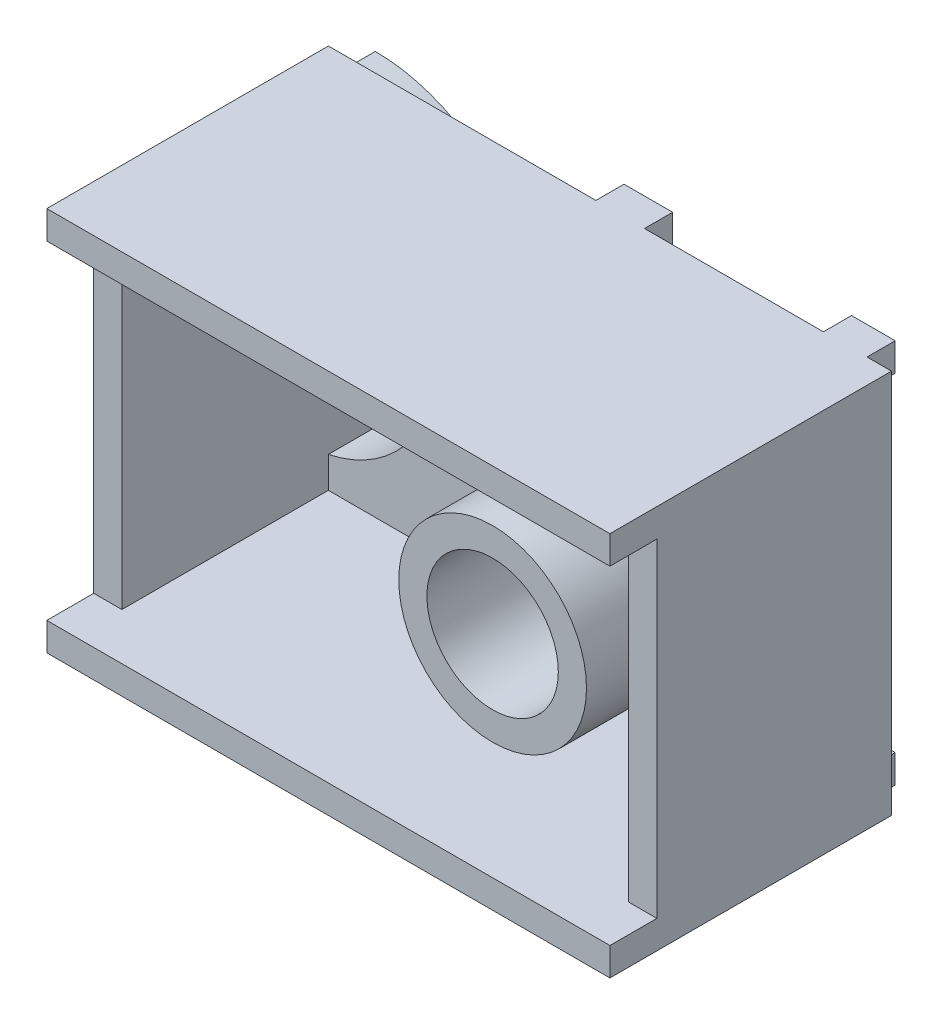
from build123d import *

# Parameters (mm, degrees)
SKETCH1_R           = 7
BOSS_EXTRUDE1_DEPTH = 25
BOSS_EXTRUDE2_DEPTH = 5
SKETCH1_4_W         = 60
SKETCH1_4_H         = 3
BOSS_EXTRUDE3_DEPTH = 30
SKETCH1_5_W         = 5.181024341
SKETCH1_5_H         = 3
SKETCH1_5_W_2       = 4.652035809
BOSS_EXTRUDE4_DEPTH = 3
SHELL2_START        = 3
SHELL2_OUTLINE_W    = 54
SHELL2_OUTLINE_H    = 35
SHELL2_OUTLINE_R    = 10
SHELL2_DEPTH        = 22
SHELL2_START_2      = -2
SHELL2_2_DEPTH      = 5


# Read off the part's stored shape, not the designer's step: Shell2
with BuildPart() as part:
    # Sketch1 → Boss-Extrude1 (new body)
    # profile 1 of 2: a face of its own
    with BuildSketch(Plane.XY):
        with BuildLine():
            Line((-28.5, 17.5), (14, 17.5))
            Line((14, 17.5), (31.5, 17.5))
            Line((31.5, 17.5), (31.5, -17.5))
            Line((31.5, -17.5), (14, -17.5))
            Line((14, -17.5), (-28.5, -17.5))
            ThreePointArc((-28.5, -17.5), (-11, 0), (-28.5, 17.5))
        make_face()
        with Locations((14, 0)):
            Circle(SKETCH1_R, mode=Mode.SUBTRACT)
    # profile 2 of 2: a face of its own
    with BuildSketch(Plane.XY):
        with BuildLine():
            ThreePointArc((-28.5, 17.5), (-11, 0), (-28.5, -17.5))
            Line((-28.5, -17.5), (-28.5, 17.5))
        make_face()
    extrude(amount=BOSS_EXTRUDE1_DEPTH)

    # Sketch1<3> → Boss-Extrude2 (add)
    with BuildSketch(Plane.XY):
        with BuildLine():
            ThreePointArc((-28.5, 17.5), (-11, 0), (-28.5, -17.5))
            Line((-28.5, -17.5), (-28.5, 17.5))
        make_face()
    extrude(amount=-BOSS_EXTRUDE2_DEPTH)

    # Sketch1<4> → Boss-Extrude3 (add)
    with BuildSketch(Plane.XY):
        with Locations((1.5, 19)):
            Rectangle(SKETCH1_4_W, SKETCH1_4_H)
        with Locations((1.5, -19)):
            Rectangle(SKETCH1_4_W, SKETCH1_4_H)
    extrude(amount=BOSS_EXTRUDE3_DEPTH)

    # Sketch1<5> → Boss-Extrude4 (add)
    with BuildSketch(Plane.XY):
        with Locations((2.590512171, 19)):
            Rectangle(SKETCH1_5_W, SKETCH1_5_H)
        with Locations((2.590512171, -19)):
            Rectangle(SKETCH1_5_W, SKETCH1_5_H)
        with Locations((26.569558343, 19)):
            Rectangle(SKETCH1_5_W_2, SKETCH1_5_H)
        with Locations((26.569558343, -19)):
            Rectangle(SKETCH1_5_W_2, SKETCH1_5_H)
    extrude(amount=-BOSS_EXTRUDE4_DEPTH)

    # Shell2 outline → Shell2 (cut)
    with BuildSketch(Plane.XY.offset(SHELL2_START)):
        with Locations((1.5, 0)):
            Rectangle(SHELL2_OUTLINE_W, SHELL2_OUTLINE_H)
        with Locations((14, 0)):
            Circle(SHELL2_OUTLINE_R, mode=Mode.SUBTRACT)
    extrude(amount=SHELL2_DEPTH, mode=Mode.SUBTRACT)

    # Shell2 2 outline → Shell2 2 (cut)
    with BuildSketch(Plane.XY.offset(SHELL2_START_2)):
        with BuildLine():
            ThreePointArc((-25.5, -14.186260959), (-14, 0), (-25.5, 14.186260959))
            Line((-25.5, 14.186260959), (-25.5, -14.186260959))
        make_face()
    extrude(amount=SHELL2_2_DEPTH, mode=Mode.SUBTRACT)


solid = part.part
